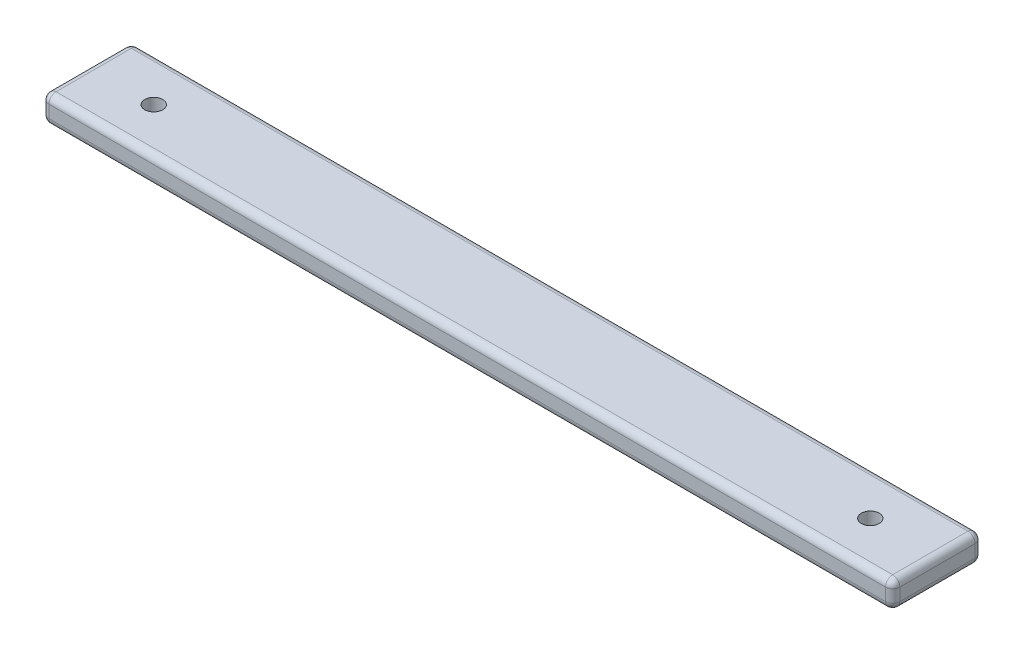
from build123d import *

# Parameters (mm, degrees)
SKETCH1_W           = 95
SKETCH1_H           = 10
BOSS_EXTRUDE1_DEPTH = 3
FILLET1_R           = 0.8
FILLET2_R           = 0.8
SKETCH2_R           = 1
CUT_EXTRUDE1_DEPTH  = 48.8565565
SKETCH3_R           = 1
BOSS_EXTRUDE2_DEPTH = 5
CUT_EXTRUDE3_START  = -2
SKETCH4_R           = 1
SKETCH4_R_2         = 0.678596162
CUT_EXTRUDE3_DEPTH  = 2


with BuildPart() as part:
    # Sketch1 → Boss-Extrude1 (new body)
    with BuildSketch(Plane(origin=(0, 0, 0), x_dir=(1, 0, 0), z_dir=(0, 1, 0))):
        Rectangle(SKETCH1_W, SKETCH1_H)
    extrude(amount=BOSS_EXTRUDE1_DEPTH)

    # Fillet1
    fillet1_edges = [part.edges().sort_by_distance(p)[0] for p in [
        (-47.5, 3, 0),
        (0, 3, 5),
        (47.5, 3, 0),
        (0, 0, 5),
        (-47.5, 0, 0),
        (0, 0, -5),
        (47.5, 0, 0),
        (0, 3, -5),
    ]]
    fillet(fillet1_edges, radius=FILLET1_R)

    # Fillet2
    # the kernel refuses this fillet: 0.8 mm, written as the material it takes off along each edge
    with BuildSketch(Plane(origin=(46.7, 0.8, 4.2), x_dir=(0, 0, 1), z_dir=(1, 0, 0))) as fillet2_piece_1_section:
        Polygon((0, 0), (FILLET2_R, 0), (FILLET2_R, FILLET2_R), (0, FILLET2_R), align=None)
    fillet2_piece_1 = extrude(amount=FILLET2_R, mode=Mode.PRIVATE)
    fillet2_piece_1 = fillet2_piece_1 - Plane(origin=(46.7, 0.8, 4.2), x_dir=(0, 0.7071067811865475, -0.7071067811865475), z_dir=(1, 0, 0)) * Sphere(FILLET2_R, mode=Mode.PRIVATE)
    add(fillet2_piece_1, mode=Mode.SUBTRACT)
    with BuildSketch(Plane(origin=(-46.7, 0.8, 4.2), x_dir=(0, 0, 1), z_dir=(-1, 0, 0))) as fillet2_piece_2_section:
        Polygon((0, 0), (FILLET2_R, 0), (FILLET2_R, -FILLET2_R), (0, -FILLET2_R), align=None)
    fillet2_piece_2 = extrude(amount=FILLET2_R, mode=Mode.PRIVATE)
    fillet2_piece_2 = fillet2_piece_2 - Plane(origin=(-46.7, 0.8, 4.2), x_dir=(0, 0.7071067811865475, -0.7071067811865475), z_dir=(-1, 0, 0)) * Sphere(FILLET2_R, mode=Mode.PRIVATE)
    add(fillet2_piece_2, mode=Mode.SUBTRACT)
    with BuildSketch(Plane(origin=(46.7, 0.8, -4.2), x_dir=(1, 0, 0), z_dir=(0, 0, -1))) as fillet2_piece_3_section:
        Polygon((0, 0), (FILLET2_R, 0), (FILLET2_R, FILLET2_R), (0, FILLET2_R), align=None)
    fillet2_piece_3 = extrude(amount=FILLET2_R, mode=Mode.PRIVATE)
    fillet2_piece_3 = fillet2_piece_3 - Plane(origin=(46.7, 0.8, -4.2), x_dir=(-0.7071067811865475, 0.7071067811865475, 0), z_dir=(0, 0, -1)) * Sphere(FILLET2_R, mode=Mode.PRIVATE)
    add(fillet2_piece_3, mode=Mode.SUBTRACT)
    with BuildSketch(Plane(origin=(-46.7, 0.8, -4.2), x_dir=(-1, 0, 0), z_dir=(0, 0, -1))) as fillet2_piece_4_section:
        Polygon((0, 0), (FILLET2_R, 0), (FILLET2_R, -FILLET2_R), (0, -FILLET2_R), align=None)
    fillet2_piece_4 = extrude(amount=FILLET2_R, mode=Mode.PRIVATE)
    fillet2_piece_4 = fillet2_piece_4 - Plane(origin=(-46.7, 0.8, -4.2), x_dir=(0.7071067811865475, 0.7071067811865475, 0), z_dir=(0, 0, -1)) * Sphere(FILLET2_R, mode=Mode.PRIVATE)
    add(fillet2_piece_4, mode=Mode.SUBTRACT)
    with BuildSketch(Plane(origin=(-46.7, 2.2, -4.2), x_dir=(-1, 0, 0), z_dir=(0, 0, -1))) as fillet2_piece_5_section:
        Polygon((0, 0), (FILLET2_R, 0), (FILLET2_R, FILLET2_R), (0, FILLET2_R), align=None)
    fillet2_piece_5 = extrude(amount=FILLET2_R, mode=Mode.PRIVATE)
    fillet2_piece_5 = fillet2_piece_5 - Plane(origin=(-46.7, 2.2, -4.2), x_dir=(0.7071067811865475, -0.7071067811865475, 0), z_dir=(0, 0, -1)) * Sphere(FILLET2_R, mode=Mode.PRIVATE)
    add(fillet2_piece_5, mode=Mode.SUBTRACT)
    with BuildSketch(Plane(origin=(46.7, 2.2, -4.2), x_dir=(1, 0, 0), z_dir=(0, 0, -1))) as fillet2_piece_6_section:
        Polygon((0, 0), (FILLET2_R, 0), (FILLET2_R, -FILLET2_R), (0, -FILLET2_R), align=None)
    fillet2_piece_6 = extrude(amount=FILLET2_R, mode=Mode.PRIVATE)
    fillet2_piece_6 = fillet2_piece_6 - Plane(origin=(46.7, 2.2, -4.2), x_dir=(-0.7071067811865475, -0.7071067811865475, 0), z_dir=(0, 0, -1)) * Sphere(FILLET2_R, mode=Mode.PRIVATE)
    add(fillet2_piece_6, mode=Mode.SUBTRACT)
    with BuildSketch(Plane(origin=(-46.7, 2.2, 4.2), x_dir=(0, 0, 1), z_dir=(-1, 0, 0))) as fillet2_piece_7_section:
        Polygon((0, 0), (FILLET2_R, 0), (FILLET2_R, FILLET2_R), (0, FILLET2_R), align=None)
    fillet2_piece_7 = extrude(amount=FILLET2_R, mode=Mode.PRIVATE)
    fillet2_piece_7 = fillet2_piece_7 - Plane(origin=(-46.7, 2.2, 4.2), x_dir=(0, -0.7071067811865475, -0.7071067811865475), z_dir=(-1, 0, 0)) * Sphere(FILLET2_R, mode=Mode.PRIVATE)
    add(fillet2_piece_7, mode=Mode.SUBTRACT)
    with BuildSketch(Plane(origin=(46.7, 2.2, 4.2), x_dir=(0, 0, 1), z_dir=(1, 0, 0))) as fillet2_piece_8_section:
        Polygon((0, 0), (FILLET2_R, 0), (FILLET2_R, -FILLET2_R), (0, -FILLET2_R), align=None)
    fillet2_piece_8 = extrude(amount=FILLET2_R, mode=Mode.PRIVATE)
    fillet2_piece_8 = fillet2_piece_8 - Plane(origin=(46.7, 2.2, 4.2), x_dir=(0, -0.7071067811865475, -0.7071067811865475), z_dir=(1, 0, 0)) * Sphere(FILLET2_R, mode=Mode.PRIVATE)
    add(fillet2_piece_8, mode=Mode.SUBTRACT)
    with BuildSketch(Plane(origin=(-47.5, 0.8, -5), x_dir=(1, 0, 0), z_dir=(0, 1, 0)), Plane(origin=(-47.5, 0.8, 5), x_dir=(0, 0, -1), z_dir=(0, 1, 0))) as fillet2_piece_9:
        with BuildLine():
            CenterArc((FILLET2_R, -FILLET2_R), FILLET2_R, 90, 90)
            Line((0, -FILLET2_R), (0, 0))
            Line((0, 0), (FILLET2_R, 0))
        make_face()
    extrude(amount=1.4, mode=Mode.SUBTRACT)
    with BuildSketch(Plane(origin=(47.5, 0.8, -5), x_dir=(-1, 0, 0), z_dir=(0, 1, 0)), Plane(origin=(47.5, 0.8, 5), x_dir=(0, 0, -1), z_dir=(0, 1, 0))) as fillet2_piece_10:
        with BuildLine():
            CenterArc((FILLET2_R, FILLET2_R), FILLET2_R, 180, 90)
            Line((0, FILLET2_R), (0, 0))
            Line((0, 0), (FILLET2_R, 0))
        make_face()
    extrude(amount=1.4, mode=Mode.SUBTRACT)

    # Sketch2 → Cut-Extrude1 (cut, through all)
    with BuildSketch(Plane(origin=(0, 3, 0), x_dir=(1, 0, 0), z_dir=(0, 1, 0))):
        with Locations(Location((0, 0, 0), (0, 0, 270))):
            Circle(SKETCH2_R)
        with Locations(Location((-40, 0, 0), (0, 0, 270))):
            Circle(SKETCH2_R)
        with Locations(Location((40, 0, 0), (0, 0, 270))):
            Circle(SKETCH2_R)
    extrude(amount=-CUT_EXTRUDE1_DEPTH, mode=Mode.SUBTRACT)

    # Sketch3 → Boss-Extrude2 (add)
    with BuildSketch(Plane(origin=(0, 3, 0), x_dir=(1, 0, 0), z_dir=(0, 1, 0))):
        with Locations(Location((0, 0, 0), (0, 0, 270))):
            Circle(SKETCH3_R)
    extrude(amount=-BOSS_EXTRUDE2_DEPTH)

    # Sketch4 → Cut-Extrude3 (cut)
    with BuildSketch(Plane.XZ.offset(2).offset(CUT_EXTRUDE3_START)):
        Circle(SKETCH4_R)
        with Locations(Location((0, 0, 0), (0, 0, 270))):
            Circle(SKETCH4_R_2, mode=Mode.SUBTRACT)
    extrude(amount=CUT_EXTRUDE3_DEPTH, mode=Mode.SUBTRACT)


solid = part.part
